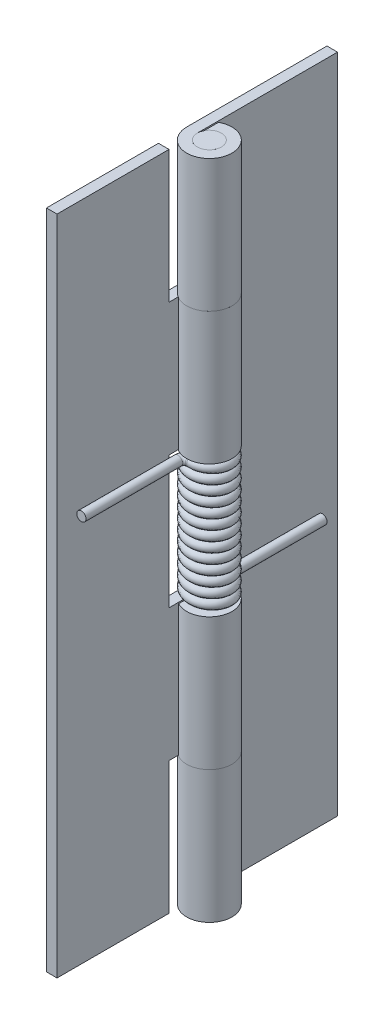
from build123d import *

# Parameters (mm, degrees)
BOSS_EXTRUDE1_DEPTH = 63.5
BOSS_EXTRUDE2_DEPTH = 63.5
SKETCH7_W           = 5.42036
SKETCH7_H           = 12.7
CUT_EXTRUDE2_DEPTH  = 66.056441399
SKETCH8_W           = 5.42036
SKETCH8_H           = 12.7
CUT_EXTRUDE3_DEPTH  = 66.056441399
SKETCH10_W          = 5.42036
SKETCH10_H          = 12.7
CUT_EXTRUDE4_DEPTH  = 66.056441399
SKETCH9_R           = 1.1557
BOSS_EXTRUDE3_DEPTH = 63.5
SKETCH14_R          = 0.4445
SWEEP2_PITCH        = 0.94488
SWEEP2_HEIGHT       = 11.811
SWEEP2_RADIUS       = 2.1717
SWEEP2_START_ANGLE  = -180
SKETCH15_R          = 0.4445
SKETCH16_R          = 0.4445


with BuildPart() as part:
    # Sketch3 → Boss-Extrude1 (new body)
    with BuildSketch(Plane(origin=(0, 0, 0), x_dir=(1, 0, 0), z_dir=(0, 1, 0))):
        with BuildLine():
            Line((1.016, 13.462), (0, 13.462))
            Line((0, 13.462), (0, 0))
            ThreePointArc((0, 0), (4.035876585, -1.114058594), (1.143, 1.912604821))
            Line((1.143, 1.912604821), (1.143, 0.52670561))
            ThreePointArc((1.143, 0.52670561), (3.295201464, -0.270900258), (1.016, 0))
            Line((1.016, 0), (1.016, 13.462))
        make_face()
    extrude(amount=BOSS_EXTRUDE1_DEPTH)

    # Sketch7 → Cut-Extrude2 (cut, through all)
    with BuildSketch(Plane(origin=(0, 0, 0), x_dir=(0, 0, -1), z_dir=(1, 0, 0))):
        with Locations((0, 69.85)):
            Rectangle(SKETCH7_W, SKETCH7_H)
        with Locations((0, 19.05)):
            Rectangle(SKETCH7_W, SKETCH7_H)
        with Locations((0, 44.45)):
            Rectangle(SKETCH7_W, SKETCH7_H)
    extrude(amount=CUT_EXTRUDE2_DEPTH, mode=Mode.SUBTRACT)

    # Sketch10 → Cut-Extrude4 (cut, through all)
    with BuildSketch(Plane(origin=(0, 0, 0), x_dir=(0, 0, -1), z_dir=(1, 0, 0))):
        with Locations((0, 31.75)):
            Rectangle(SKETCH10_W, SKETCH10_H)
    extrude(amount=CUT_EXTRUDE4_DEPTH, mode=Mode.SUBTRACT)


with BuildPart() as body_2:
    # Sketch4 → Boss-Extrude2 (new body)
    with BuildSketch(Plane(origin=(0, 0, 0), x_dir=(1, 0, 0), z_dir=(0, 1, 0))):
        with BuildLine():
            Line((0, 0), (0, -13.462))
            Line((0, -13.462), (1.016, -13.462))
            Line((1.016, -13.462), (1.016, 0))
            ThreePointArc((1.016, 0), (3.295201464, 0.270900258), (1.143, -0.52670561))
            Line((1.143, -0.52670561), (1.143, -1.912604821))
            ThreePointArc((1.143, -1.912604821), (4.035876585, 1.114058594), (0, 0))
        make_face()
    extrude(amount=BOSS_EXTRUDE2_DEPTH)

    # Sketch8 → Cut-Extrude3 (cut, through all)
    with BuildSketch(Plane(origin=(0, 0, 0), x_dir=(0, 0, -1), z_dir=(1, 0, 0))):
        with Locations((0, 6.35)):
            Rectangle(SKETCH8_W, SKETCH8_H)
        with Locations((0, 31.75)):
            Rectangle(SKETCH8_W, SKETCH8_H)
        with Locations((0, 57.15)):
            Rectangle(SKETCH8_W, SKETCH8_H)
    extrude(amount=CUT_EXTRUDE3_DEPTH, mode=Mode.SUBTRACT)


with BuildPart() as body_3:
    # Sketch9 → Boss-Extrude3 (new body)
    with BuildSketch(Plane(origin=(0, 0, 0), x_dir=(1, 0, 0), z_dir=(0, 1, 0))):
        with Locations(Location((2.1717, 0, 0), (0, 0, 270))):
            Circle(SKETCH9_R)
    extrude(amount=BOSS_EXTRUDE3_DEPTH)


with BuildPart() as body_4:
    # Sweep1: sweep along a path in Sketch12<2>
    with BuildLine(Plane(origin=(0, 25.8445, 0), x_dir=(1, 0, 0), z_dir=(0, 1, 0))) as sweep1_path:
        Line((1.905, 11.5697), (1.905, 2.30505))
        ThreePointArc((1.905, 2.30505), (1.944057311, 2.210757311), (2.03835, 2.1717))
        Line((2.03835, 2.1717), (2.1717, 2.1717))
    # Sketch14 → Sweep1 (sweep)
    with BuildSketch(Plane.XY.offset(-11.5697)):
        with Locations((1.4605, 25.8445)):
            Circle(SKETCH14_R)
    sweep(path=sweep1_path.line)

    # Sweep2: sweep along a helix
    with BuildLine() as sweep2_path:
        add(Helix(SWEEP2_PITCH, SWEEP2_HEIGHT, SWEEP2_RADIUS, center=(2.1717, 25.8445, 0), direction=(0, 1, 0), lefthand=True, mode=Mode.PRIVATE).rotate(Axis((2.1717, 25.8445, 0), (0, 1, 0)), SWEEP2_START_ANGLE))
    # Sketch15 → Sweep2 (sweep)
    with BuildSketch(Plane(origin=(2.1717, 0, 0), x_dir=(0, 0, -1), z_dir=(1, 0, 0))):
        with Locations((1.7272, 25.8445)):
            Circle(SKETCH15_R)
    sweep(path=sweep2_path.line, is_frenet=True)

    # Sweep3: sweep along a path in Sketch13<2>
    with BuildLine(Plane(origin=(0, 37.6555, 0), x_dir=(1, 0, 0), z_dir=(0, 1, 0))) as sweep3_path:
        Line((1.905, -11.5697), (1.905, -2.30505))
        ThreePointArc((1.905, -2.30505), (1.944057311, -2.210757311), (2.03835, -2.1717))
        Line((2.03835, -2.1717), (2.1717, -2.1717))
    # Sketch16 → Sweep3 (sweep)
    with BuildSketch(Plane.ZY.offset(-2.1717)):
        with Locations((1.7272, 37.6555)):
            Circle(SKETCH16_R)
    sweep(path=sweep3_path.line)


solid = Compound([part.part, body_2.part, body_3.part, body_4.part])
